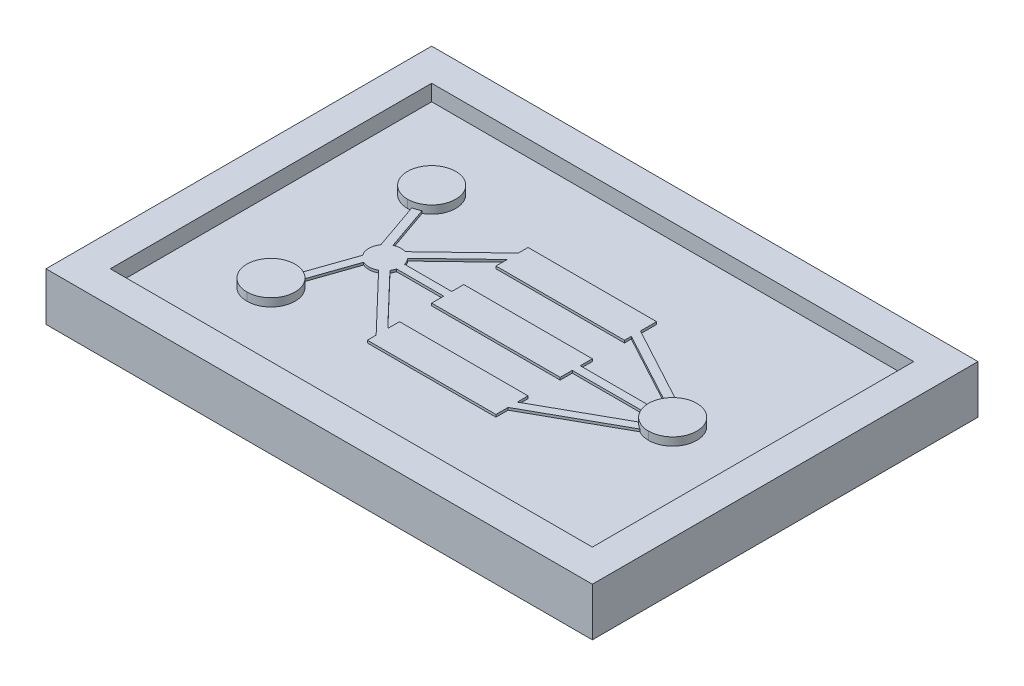
from build123d import *

# Parameters (mm, degrees)
CROQUIS1_W              = 34
CROQUIS1_H              = 24
SALIENTE_EXTRUIR1_DEPTH = 3
CAVIDAD1_START          = 2
CAVIDAD1_OUTLINE_W      = 30
CAVIDAD1_OUTLINE_H      = 20
CAVIDAD1_DEPTH          = 1
CAVIDAD1_START_2        = 2.15
CAVIDAD1_2_DEPTH        = 0.85
CAVIDAD1_START_3        = 2.5
CAVIDAD1_3_OUTLINE_R    = 1.5
CAVIDAD1_3_DEPTH        = 0.5
SALIENTE_EXTRUIR3_DEPTH = 0.5
CROQUIS6_W              = 7.77529117
CROQUIS6_H              = 2
CROQUIS6_W_2            = 2
CROQUIS6_H_2            = 19.575879517
CROQUIS6_W_3            = 7.699177506
CROQUIS6_H_3            = 2.365035227
CROQUIS6_W_4            = 2.895421418
CROQUIS6_W_5            = 7.822528086
CROQUIS6_H_4            = 2.895421418
CROQUIS6_W_6            = 2.695737182
CORTAR_EXTRUIR1_DEPTH   = 0.5


# Read off the part's stored shape, not the designer's step: Cavidad1
with BuildPart() as part:
    # Croquis1 → Saliente-Extruir1 (new body)
    with BuildSketch(Plane(origin=(0, 0, 0), x_dir=(1, 0, 0), z_dir=(0, 1, 0))):
        Rectangle(CROQUIS1_W, CROQUIS1_H)
    extrude(amount=SALIENTE_EXTRUIR1_DEPTH)

    # Cavidad1 outline → Cavidad1 (cut)
    # profile 1 of 3: a face of its own
    with BuildSketch(Plane(origin=(0, 0, 0), x_dir=(1, 0, 0), z_dir=(0, 1, 0)).offset(CAVIDAD1_START)):
        Rectangle(CAVIDAD1_OUTLINE_W, CAVIDAD1_OUTLINE_H)
        with BuildLine():
            Line((-9.751477048, -3.520731146), (-8.727521258, -0.568876422))
            ThreePointArc((-8.727521258, -0.568876422), (-8.905098242, 0), (-8.727521258, 0.568876422))
            Line((-8.727521258, 0.568876422), (-9.751477048, 3.520731146))
            ThreePointArc((-9.751477048, 3.520731146), (-10.491591745, 6.417158268), (-9.279090958, 3.684595061))
            Line((-9.279090958, 3.684595061), (-8.317043268, 0.911208701))
            ThreePointArc((-8.317043268, 0.911208701), (-8.115800994, 0.977550178), (-7.905098242, 1))
            ThreePointArc((-7.905098242, 1), (-7.74739704, 0.987486876), (-7.593642508, 0.950260662))
            Line((-7.593642508, 0.950260662), (-4, 4.391446273))
            Line((-4, 4.391446273), (-4, 5))
            Line((-4, 5), (4, 5))
            Line((4, 5), (4, 3.993093842))
            Line((4, 3.993093842), (9.128751089, 1.221034535))
            ThreePointArc((9.128751089, 1.221034535), (11.497837988, 0.08050691), (9.264650579, -1.307387176))
            Line((9.264650579, -1.307387176), (4, -4.242890617))
            Line((4, -4.242890617), (4, -5))
            Line((4, -5), (-4, -5))
            Line((-4, -5), (-4, -4.453815845))
            Line((-4, -4.453815845), (-7.424912859, -0.87716703))
            ThreePointArc((-7.424912859, -0.87716703), (-7.866968261, -0.999272788), (-8.317043268, -0.911208701))
            Line((-8.317043268, -0.911208701), (-9.279090958, -3.684595061))
            ThreePointArc((-9.279090958, -3.684595061), (-10.491591745, -6.417158268), (-9.751477048, -3.520731146))
        make_face(mode=Mode.SUBTRACT)
    # profile 2 of 3: a face of its own
    with BuildSketch(Plane(origin=(0, 0, 0), x_dir=(1, 0, 0), z_dir=(0, 1, 0)).offset(CAVIDAD1_START)):
        with BuildLine():
            ThreePointArc((8.520980054, 0.25), (8.609737932, 0.563179707), (8.763967569, 0.849837532))
            Line((8.763967569, 0.849837532), (4, 3.424733527))
            Line((4, 3.424733527), (4, 3))
            Line((4, 3), (-4, 3))
            Line((-4, 3), (-4, 3.699176151))
            Line((-4, 3.699176151), (-7.163035026, 0.670329906))
            ThreePointArc((-7.163035026, 0.670329906), (-7.024496987, 0.473858025), (-6.936852406, 0.25))
            Line((-6.936852406, 0.25), (-4, 0.25))
            Line((-4, 0.25), (-4, 1))
            Line((-4, 1), (4, 1))
            Line((4, 1), (4, 0.25))
            Line((4, 0.25), (8.520980054, 0.25))
        make_face()
    # profile 3 of 3: a face of its own
    with BuildSketch(Plane(origin=(0, 0, 0), x_dir=(1, 0, 0), z_dir=(0, 1, 0)).offset(CAVIDAD1_START)):
        with BuildLine():
            Line((4, -3.670417072), (8.851743131, -0.96514567))
            ThreePointArc((8.851743131, -0.96514567), (8.63856539, -0.629679127), (8.520980054, -0.25))
            Line((8.520980054, -0.25), (4, -0.25))
            Line((4, -0.25), (4, -1))
            Line((4, -1), (-4, -1))
            Line((-4, -1), (-4, -0.25))
            Line((-4, -0.25), (-6.936852406, -0.25))
            ThreePointArc((-6.936852406, -0.25), (-6.987424899, -0.397335669), (-7.060265081, -0.535029839))
            Line((-7.060265081, -0.535029839), (-4, -3.730875667))
            Line((-4, -3.730875667), (-4, -3))
            Line((-4, -3), (4, -3))
            Line((4, -3), (4, -3.670417072))
        make_face()
    extrude(amount=CAVIDAD1_DEPTH, mode=Mode.SUBTRACT)

    # Cavidad1 2 outline → Cavidad1 2 (cut)
    with BuildSketch(Plane(origin=(0, 0, 0), x_dir=(1, 0, 0), z_dir=(0, 1, 0)).offset(CAVIDAD1_START_2)):
        with BuildLine():
            ThreePointArc((-8.727521258, 0.568876422), (-8.905098242, 0), (-8.727521258, -0.568876422))
            Line((-8.727521258, -0.568876422), (-9.751477048, -3.520731146))
            ThreePointArc((-9.751477048, -3.520731146), (-9.508408255, -3.582841732), (-9.279090958, -3.684595061))
            Line((-9.279090958, -3.684595061), (-8.317043268, -0.911208701))
            ThreePointArc((-8.317043268, -0.911208701), (-7.866968261, -0.999272788), (-7.424912859, -0.87716703))
            Line((-7.424912859, -0.87716703), (-4, -4.453815845))
            Line((-4, -4.453815845), (-4, -5))
            Line((-4, -5), (4, -5))
            Line((4, -5), (4, -4.242890617))
            Line((4, -4.242890617), (9.264650579, -1.307387176))
            ThreePointArc((9.264650579, -1.307387176), (9.042777207, -1.154869917), (8.851743131, -0.96514567))
            Line((8.851743131, -0.96514567), (4, -3.670417072))
            Line((4, -3.670417072), (4, -3))
            Line((4, -3), (-4, -3))
            Line((-4, -3), (-4, -3.730875667))
            Line((-4, -3.730875667), (-7.060265081, -0.535029839))
            ThreePointArc((-7.060265081, -0.535029839), (-6.987424899, -0.397335669), (-6.936852406, -0.25))
            Line((-6.936852406, -0.25), (-4, -0.25))
            Line((-4, -0.25), (-4, -1))
            Line((-4, -1), (4, -1))
            Line((4, -1), (4, -0.25))
            Line((4, -0.25), (8.520980054, -0.25))
            ThreePointArc((8.520980054, -0.25), (8.5, 0), (8.520980054, 0.25))
            Line((8.520980054, 0.25), (4, 0.25))
            Line((4, 0.25), (4, 1))
            Line((4, 1), (-4, 1))
            Line((-4, 1), (-4, 0.25))
            Line((-4, 0.25), (-6.936852406, 0.25))
            ThreePointArc((-6.936852406, 0.25), (-7.024496987, 0.473858025), (-7.163035026, 0.670329906))
            Line((-7.163035026, 0.670329906), (-4, 3.699176151))
            Line((-4, 3.699176151), (-4, 3))
            Line((-4, 3), (4, 3))
            Line((4, 3), (4, 3.424733527))
            Line((4, 3.424733527), (8.763967569, 0.849837532))
            ThreePointArc((8.763967569, 0.849837532), (8.930137641, 1.051377446), (9.128751089, 1.221034535))
            Line((9.128751089, 1.221034535), (4, 3.993093842))
            Line((4, 3.993093842), (4, 5))
            Line((4, 5), (-4, 5))
            Line((-4, 5), (-4, 4.391446273))
            Line((-4, 4.391446273), (-7.593642508, 0.950260662))
            ThreePointArc((-7.593642508, 0.950260662), (-7.74739704, 0.987486876), (-7.905098242, 1))
            ThreePointArc((-7.905098242, 1), (-8.115800994, 0.977550178), (-8.317043268, 0.911208701))
            Line((-8.317043268, 0.911208701), (-9.279090958, 3.684595061))
            ThreePointArc((-9.279090958, 3.684595061), (-9.508408255, 3.582841732), (-9.751477048, 3.520731146))
            Line((-9.751477048, 3.520731146), (-8.727521258, 0.568876422))
        make_face()
    extrude(amount=CAVIDAD1_2_DEPTH, mode=Mode.SUBTRACT)

    # Cavidad1 3 outline → Cavidad1 3 (cut)
    with BuildSketch(Plane(origin=(0, 0, 0), x_dir=(1, 0, 0), z_dir=(0, 1, 0)).offset(CAVIDAD1_START_3)):
        with Locations((-10, -5)):
            Circle(CAVIDAD1_3_OUTLINE_R)
        with Locations((-10, 5)):
            Circle(CAVIDAD1_3_OUTLINE_R)
        with Locations((10, 0)):
            Circle(CAVIDAD1_3_OUTLINE_R)
    extrude(amount=CAVIDAD1_3_DEPTH, mode=Mode.SUBTRACT)

    # Croquis5 → Saliente-Extruir3 (add)
    with BuildSketch(Plane(origin=(0, 3, 0), x_dir=(1, 0, 0), z_dir=(0, 1, 0))):
        Polygon((-17, 12), (-7, 12), (-7, 10), (-15, 10), (-15, -10), (-7, -10), (-7, -12), (-17, -12), align=None)
        Polygon((7, 12), (17, 12), (17, -12), (7, -12), (7, -10), (15, -10), (15, 10), (7, 10), align=None)
    extrude(amount=SALIENTE_EXTRUIR3_DEPTH)

    # Croquis6 → Cortar-Extruir1 (cut)
    with BuildSketch(Plane(origin=(0, 3.5, 0), x_dir=(1, 0, 0), z_dir=(0, 1, 0))):
        with Locations((-10.887645585, -11)):
            Rectangle(CROQUIS6_W, CROQUIS6_H)
        with Locations((-16, -0.159576746)):
            Rectangle(CROQUIS6_W_2, CROQUIS6_H_2)
        with Locations((-10.887645585, 11)):
            Rectangle(CROQUIS6_W, CROQUIS6_H)
        Polygon((-17, 12), (-17, 9.628363012), (-15, 9.628363012), (-15, 10), (-14.77529117, 10), (-14.77529117, 12), align=None)
        Polygon((-15, -9.947516505), (-17, -9.947516505), (-17, -12), (-14.77529117, -12), (-14.77529117, -10), (-15, -10), align=None)
        with Locations((10.830941942, -11.045685777)):
            Rectangle(CROQUIS6_W_3, CROQUIS6_H_3)
        with Locations((16.128241404, -11.045685777)):
            Rectangle(CROQUIS6_W_4, CROQUIS6_H_3)
        Polygon((17.575952113, -12.22820339), (14.680530695, -12.22820339), (14.680530695, -12.891712404), (17.84219776, -12.891712404), (17.84219776, 13.499887418), (14.680530695, 13.499887418), (14.680530695, 12.667869769), (17.376267877, 12.667869769), (17.376267877, 9.772448351), (14.680530695, 9.772448351), (14.680530695, -9.863168163), (17.575952113, -9.863168163), align=None)
        with Locations((10.769266652, 11.22015906)):
            Rectangle(CROQUIS6_W_5, CROQUIS6_H_4)
        with Locations((16.028399286, 11.22015906)):
            Rectangle(CROQUIS6_W_6, CROQUIS6_H_4)
    extrude(amount=-CORTAR_EXTRUIR1_DEPTH, mode=Mode.SUBTRACT)


solid = part.part
